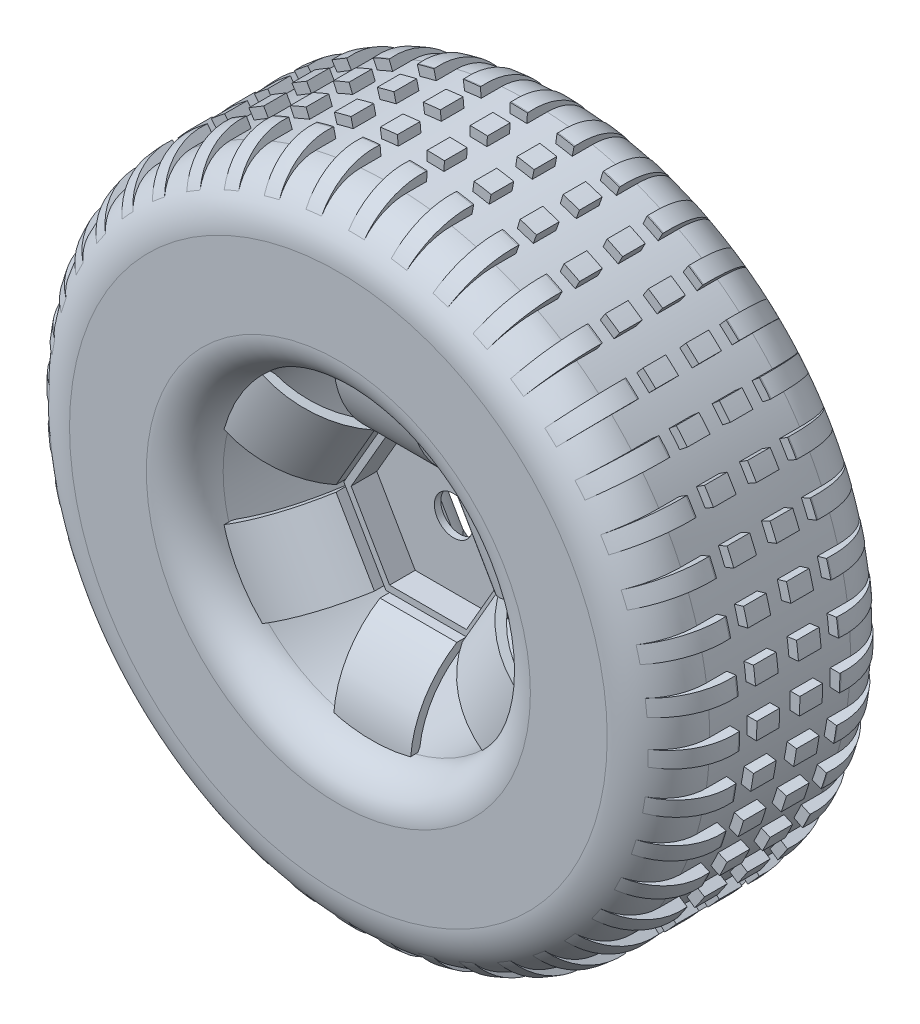
from build123d import *

# Parameters (mm, degrees)
SKETCH2_R                = 3
BOSS_EXTRUDE1_DEPTH      = 5
SHELL2_T                 = -1
SKETCH7_R                = 3
BOSS_EXTRUDE2_DEPTH      = 5
SHELL3_START             = -5
SHELL3_OUTLINE_R         = 3
SHELL3_DEPTH             = 5
SKETCH8_W                = 12
SKETCH8_H                = 3
CIRPATTERN7_COUNT        = 6
MIRROR1_COPY_1_SKETCH_W  = 12
MIRROR1_COPY_1_SKETCH_H  = 3
MIRROR1_COPY_2_SKETCH_W  = 12
MIRROR1_COPY_2_SKETCH_H  = 3
MIRROR1_COPY_3_SKETCH_W  = 12
MIRROR1_COPY_3_SKETCH_H  = 3
MIRROR1_COPY_4_SKETCH_W  = 12
MIRROR1_COPY_4_SKETCH_H  = 3
MIRROR1_COPY_5_SKETCH_W  = 12
MIRROR1_COPY_5_SKETCH_H  = 3
SKETCH12_W               = 3.543897996
SKETCH12_H               = 1.5
REVOLVE3_ANGLE           = 3
CIRPATTERN8_COUNT        = 44
MIRROR2_COPY_1_SKETCH_W  = 3.543897996
MIRROR2_COPY_1_SKETCH_H  = 1.5
MIRROR2_COPY_1_ANGLE     = 3
MIRROR2_COPY_2_SKETCH_W  = 3.543897996
MIRROR2_COPY_2_SKETCH_H  = 1.5
MIRROR2_COPY_2_ANGLE     = 3
MIRROR2_COPY_3_SKETCH_W  = 3.543897996
MIRROR2_COPY_3_SKETCH_H  = 1.5
MIRROR2_COPY_3_ANGLE     = 3
MIRROR2_COPY_4_SKETCH_W  = 3.543897996
MIRROR2_COPY_4_SKETCH_H  = 1.5
MIRROR2_COPY_4_ANGLE     = 3
MIRROR2_COPY_5_SKETCH_W  = 3.543897996
MIRROR2_COPY_5_SKETCH_H  = 1.5
MIRROR2_COPY_5_ANGLE     = 3
MIRROR2_COPY_6_SKETCH_W  = 3.543897996
MIRROR2_COPY_6_SKETCH_H  = 1.5
MIRROR2_COPY_6_ANGLE     = 3
MIRROR2_COPY_7_SKETCH_W  = 3.543897996
MIRROR2_COPY_7_SKETCH_H  = 1.5
MIRROR2_COPY_7_ANGLE     = 3
MIRROR2_COPY_8_SKETCH_W  = 3.543897996
MIRROR2_COPY_8_SKETCH_H  = 1.5
MIRROR2_COPY_8_ANGLE     = 3
MIRROR2_COPY_9_SKETCH_W  = 3.543897996
MIRROR2_COPY_9_SKETCH_H  = 1.5
MIRROR2_COPY_9_ANGLE     = 3
MIRROR2_COPY_10_SKETCH_W = 3.543897996
MIRROR2_COPY_10_SKETCH_H = 1.5
MIRROR2_COPY_10_ANGLE    = 3
MIRROR2_COPY_11_SKETCH_W = 3.543897996
MIRROR2_COPY_11_SKETCH_H = 1.5
MIRROR2_COPY_11_ANGLE    = 3
MIRROR2_COPY_12_SKETCH_W = 3.543897996
MIRROR2_COPY_12_SKETCH_H = 1.5
MIRROR2_COPY_12_ANGLE    = 3
MIRROR2_COPY_13_SKETCH_W = 3.543897996
MIRROR2_COPY_13_SKETCH_H = 1.5
MIRROR2_COPY_13_ANGLE    = 3
MIRROR2_COPY_14_SKETCH_W = 3.543897996
MIRROR2_COPY_14_SKETCH_H = 1.5
MIRROR2_COPY_14_ANGLE    = 3
MIRROR2_COPY_15_SKETCH_W = 3.543897996
MIRROR2_COPY_15_SKETCH_H = 1.5
MIRROR2_COPY_15_ANGLE    = 3
MIRROR2_COPY_16_SKETCH_W = 3.543897996
MIRROR2_COPY_16_SKETCH_H = 1.5
MIRROR2_COPY_16_ANGLE    = 3
MIRROR2_COPY_17_SKETCH_W = 3.543897996
MIRROR2_COPY_17_SKETCH_H = 1.5
MIRROR2_COPY_17_ANGLE    = 3
MIRROR2_COPY_18_SKETCH_W = 3.543897996
MIRROR2_COPY_18_SKETCH_H = 1.5
MIRROR2_COPY_18_ANGLE    = 3
MIRROR2_COPY_19_SKETCH_W = 3.543897996
MIRROR2_COPY_19_SKETCH_H = 1.5
MIRROR2_COPY_19_ANGLE    = 3
MIRROR2_COPY_20_SKETCH_W = 3.543897996
MIRROR2_COPY_20_SKETCH_H = 1.5
MIRROR2_COPY_20_ANGLE    = 3
MIRROR2_COPY_21_SKETCH_W = 3.543897996
MIRROR2_COPY_21_SKETCH_H = 1.5
MIRROR2_COPY_21_ANGLE    = 3
MIRROR2_COPY_22_SKETCH_W = 3.543897996
MIRROR2_COPY_22_SKETCH_H = 1.5
MIRROR2_COPY_22_ANGLE    = 3
MIRROR2_COPY_23_SKETCH_W = 3.543897996
MIRROR2_COPY_23_SKETCH_H = 1.5
MIRROR2_COPY_23_ANGLE    = 3
MIRROR2_COPY_24_SKETCH_W = 3.543897996
MIRROR2_COPY_24_SKETCH_H = 1.5
MIRROR2_COPY_24_ANGLE    = 3
MIRROR2_COPY_25_SKETCH_W = 3.543897996
MIRROR2_COPY_25_SKETCH_H = 1.5
MIRROR2_COPY_25_ANGLE    = 3
MIRROR2_COPY_26_SKETCH_W = 3.543897996
MIRROR2_COPY_26_SKETCH_H = 1.5
MIRROR2_COPY_26_ANGLE    = 3
MIRROR2_COPY_27_SKETCH_W = 3.543897996
MIRROR2_COPY_27_SKETCH_H = 1.5
MIRROR2_COPY_27_ANGLE    = 3
MIRROR2_COPY_28_SKETCH_W = 3.543897996
MIRROR2_COPY_28_SKETCH_H = 1.5
MIRROR2_COPY_28_ANGLE    = 3
MIRROR2_COPY_29_SKETCH_W = 3.543897996
MIRROR2_COPY_29_SKETCH_H = 1.5
MIRROR2_COPY_29_ANGLE    = 3
MIRROR2_COPY_30_SKETCH_W = 3.543897996
MIRROR2_COPY_30_SKETCH_H = 1.5
MIRROR2_COPY_30_ANGLE    = 3
MIRROR2_COPY_31_SKETCH_W = 3.543897996
MIRROR2_COPY_31_SKETCH_H = 1.5
MIRROR2_COPY_31_ANGLE    = 3
MIRROR2_COPY_32_SKETCH_W = 3.543897996
MIRROR2_COPY_32_SKETCH_H = 1.5
MIRROR2_COPY_32_ANGLE    = 3
MIRROR2_COPY_33_SKETCH_W = 3.543897996
MIRROR2_COPY_33_SKETCH_H = 1.5
MIRROR2_COPY_33_ANGLE    = 3
MIRROR2_COPY_34_SKETCH_W = 3.543897996
MIRROR2_COPY_34_SKETCH_H = 1.5
MIRROR2_COPY_34_ANGLE    = 3
MIRROR2_COPY_35_SKETCH_W = 3.543897996
MIRROR2_COPY_35_SKETCH_H = 1.5
MIRROR2_COPY_35_ANGLE    = 3
MIRROR2_COPY_36_SKETCH_W = 3.543897996
MIRROR2_COPY_36_SKETCH_H = 1.5
MIRROR2_COPY_36_ANGLE    = 3
MIRROR2_COPY_37_SKETCH_W = 3.543897996
MIRROR2_COPY_37_SKETCH_H = 1.5
MIRROR2_COPY_37_ANGLE    = 3
MIRROR2_COPY_38_SKETCH_W = 3.543897996
MIRROR2_COPY_38_SKETCH_H = 1.5
MIRROR2_COPY_38_ANGLE    = 3
MIRROR2_COPY_39_SKETCH_W = 3.543897996
MIRROR2_COPY_39_SKETCH_H = 1.5
MIRROR2_COPY_39_ANGLE    = 3
MIRROR2_COPY_40_SKETCH_W = 3.543897996
MIRROR2_COPY_40_SKETCH_H = 1.5
MIRROR2_COPY_40_ANGLE    = 3
MIRROR2_COPY_41_SKETCH_W = 3.543897996
MIRROR2_COPY_41_SKETCH_H = 1.5
MIRROR2_COPY_41_ANGLE    = 3
MIRROR2_COPY_42_SKETCH_W = 3.543897996
MIRROR2_COPY_42_SKETCH_H = 1.5
MIRROR2_COPY_42_ANGLE    = 3
MIRROR2_COPY_43_SKETCH_W = 3.543897996
MIRROR2_COPY_43_SKETCH_H = 1.5
MIRROR2_COPY_43_ANGLE    = 3


# Read off the part's stored shape, not the designer's step: Shell3
with BuildPart() as part:
    # Sketch1 → Revolve2 (revolve)
    with BuildSketch(Plane(origin=(0, 0, 0), x_dir=(0, 0, -1), z_dir=(1, 0, 0)), mode=Mode.PRIVATE) as revolve2_sk:
        with BuildLine():
            Line((-13, 24), (13, 24))
            ThreePointArc((13, 24), (17.242640687, 25.757359313), (19, 30))
            Line((19, 30), (19, 42))
            ThreePointArc((19, 42), (16.656854249, 47.656854249), (11, 50))
            Line((11, 50), (-11, 50))
            ThreePointArc((-11, 50), (-16.656854249, 47.656854249), (-19, 42))
            Line((-19, 42), (-19, 30))
            ThreePointArc((-19, 30), (-17.242640687, 25.757359313), (-13, 24))
        make_face()
    revolve(revolve2_sk.sketch.rotate(Axis((0, 0, 0), (0, 0, -1)), 90), axis=Axis((0, 0, 0), (0, 0, -1)))



with BuildPart() as body_2:
    # Sketch2 → Boss-Extrude1 (new body)
    with BuildSketch(Plane.XY):
        Polygon((6.577350269, 11.392304845), (-6.577350269, 11.392304845), (-13.154700538, 0), (-6.577350269, -11.392304845), (6.577350269, -11.392304845), (13.154700538, 0), align=None)
        Circle(SKETCH2_R, mode=Mode.SUBTRACT)
    extrude(amount=BOSS_EXTRUDE1_DEPTH)

    # Shell2
    shell2_openings = [body_2.faces().sort_by_distance(p)[0] for p in [
        (0, 11.044264183, 5),
        (-3, 0, 2.5),
    ]]
    offset(amount=SHELL2_T, openings=shell2_openings, kind=Kind.INTERSECTION)

    # Sketch7 → Boss-Extrude2 (add)
    with BuildSketch(Plane(origin=(0, 0, 0), x_dir=(-1, 0, 0), z_dir=(0, 0, -1))):
        Polygon((13.154700538, 0), (6.577350269, 11.392304845), (-6.577350269, 11.392304845), (-13.154700538, 0), (-6.577350269, -11.392304845), (6.577350269, -11.392304845), align=None)
        Circle(SKETCH7_R, mode=Mode.SUBTRACT)
    extrude(amount=BOSS_EXTRUDE2_DEPTH)

    # Shell3 outline → Shell3 (cut)
    with BuildSketch(Plane.XY.offset(SHELL3_START)):
        Polygon((6, 10.392304845), (-6, 10.392304845), (-12, 0), (-6, -10.392304845), (6, -10.392304845), (12, 0), align=None)
        Circle(SHELL3_OUTLINE_R, mode=Mode.SUBTRACT)
    extrude(amount=SHELL3_DEPTH, mode=Mode.SUBTRACT)


with BuildPart() as part_1:
    add(part.part)

    add(body_2.part)  # Sweep1 merges body 2
    # Sweep1: sweep along a path in Sketch9
    with BuildLine(Plane(origin=(0, 0, 0), x_dir=(0, 0, -1), z_dir=(1, 0, 0))) as sweep1_path:
        ThreePointArc((5, 11.392304845), (10.725518806, 16.601253611), (13, 24))
    # Sketch8 → Sweep1 (sweep)
    with BuildSketch(Plane(origin=(0, 11.392304845, 0), x_dir=(1, 0, 0), z_dir=(0, 1, 0))):
        with Locations((0, 5)):
            Rectangle(SKETCH8_W, SKETCH8_H)
    sweep1 = sweep(path=sweep1_path.line)

    # CirPattern7: Sweep1 ×6 about axis
    cirpattern7_axis = Axis((0, 0, 0), (0, 0, 1))
    for i in range(1, CIRPATTERN7_COUNT):
        add(sweep1.rotate(cirpattern7_axis, i * 360 / CIRPATTERN7_COUNT))

    # Mirror1: Sweep1 across plane
    add(sweep1.mirror(Plane.XY))

    # Mirror1 copy 1: sweep along a path in Mirror1 copy 1 path
    with BuildLine(Plane(origin=(0, 0, 0), x_dir=(0, 0, 1), z_dir=(0.5000000000000001, 0.8660254037844386, 0))) as mirror1_copy_1_path:
        ThreePointArc((5, -11.392304845), (10.725518806, -16.601253611), (13, -24))
    # Mirror1 copy 1 sketch → Mirror1 copy 1 (sweep)
    with BuildSketch(Plane(origin=(-9.866025404, 5.696152423, 0), x_dir=(0.5000000000000001, 0.8660254037844386, 0), z_dir=(-0.8660254037844386, 0.5000000000000001, 0))):
        with Locations((0, -5)):
            Rectangle(MIRROR1_COPY_1_SKETCH_W, MIRROR1_COPY_1_SKETCH_H)
    sweep(path=mirror1_copy_1_path.line)

    # Mirror1 copy 2: sweep along a path in Mirror1 copy 2 path
    with BuildLine(Plane(origin=(0, 0, 0), x_dir=(0, 0, 1), z_dir=(-0.4999999999999998, 0.8660254037844387, 0))) as mirror1_copy_2_path:
        ThreePointArc((5, -11.392304845), (10.725518806, -16.601253611), (13, -24))
    # Mirror1 copy 2 sketch → Mirror1 copy 2 (sweep)
    with BuildSketch(Plane(origin=(-9.866025404, -5.696152423, 0), x_dir=(-0.4999999999999998, 0.8660254037844387, 0), z_dir=(-0.8660254037844387, -0.4999999999999998, 0))):
        with Locations((0, -5)):
            Rectangle(MIRROR1_COPY_2_SKETCH_W, MIRROR1_COPY_2_SKETCH_H)
    sweep(path=mirror1_copy_2_path.line)

    # Mirror1 copy 3: sweep along a path in Mirror1 copy 3 path
    with BuildLine(Plane.ZY) as mirror1_copy_3_path:
        ThreePointArc((5, -11.392304845), (10.725518806, -16.601253611), (13, -24))
    # Mirror1 copy 3 sketch → Mirror1 copy 3 (sweep)
    with BuildSketch(Plane(origin=(0, -11.392304845, 0), x_dir=(-1, 0, 0), z_dir=(0, -1, 0))):
        with Locations((0, -5)):
            Rectangle(MIRROR1_COPY_3_SKETCH_W, MIRROR1_COPY_3_SKETCH_H)
    sweep(path=mirror1_copy_3_path.line)

    # Mirror1 copy 4: sweep along a path in Mirror1 copy 4 path
    with BuildLine(Plane(origin=(0, 0, 0), x_dir=(0, 0, 1), z_dir=(-0.5000000000000004, -0.8660254037844384, 0))) as mirror1_copy_4_path:
        ThreePointArc((5, -11.392304845), (10.725518806, -16.601253611), (13, -24))
    # Mirror1 copy 4 sketch → Mirror1 copy 4 (sweep)
    with BuildSketch(Plane(origin=(9.866025404, -5.696152423, 0), x_dir=(-0.5000000000000004, -0.8660254037844384, 0), z_dir=(0.8660254037844384, -0.5000000000000004, 0))):
        with Locations((0, -5)):
            Rectangle(MIRROR1_COPY_4_SKETCH_W, MIRROR1_COPY_4_SKETCH_H)
    sweep(path=mirror1_copy_4_path.line)

    # Mirror1 copy 5: sweep along a path in Mirror1 copy 5 path
    with BuildLine(Plane(origin=(0, 0, 0), x_dir=(0, 0, 1), z_dir=(0.5000000000000001, -0.8660254037844386, 0))) as mirror1_copy_5_path:
        ThreePointArc((5, -11.392304845), (10.725518806, -16.601253611), (13, -24))
    # Mirror1 copy 5 sketch → Mirror1 copy 5 (sweep)
    with BuildSketch(Plane(origin=(9.866025404, 5.696152423, 0), x_dir=(0.5000000000000001, -0.8660254037844386, 0), z_dir=(0.8660254037844386, 0.5000000000000001, 0))):
        with Locations((0, -5)):
            Rectangle(MIRROR1_COPY_5_SKETCH_W, MIRROR1_COPY_5_SKETCH_H)
    sweep(path=mirror1_copy_5_path.line)

    # Sketch12 → Revolve3 (revolve)
    with BuildSketch(Plane(origin=(0, 0, 0), x_dir=(0, 0, -1), z_dir=(1, 0, 0))):
        with BuildLine():
            Line((8, 51.5), (7.833879781, 51.5))
            Line((7.833879781, 51.5), (7.833879781, 50))
            Line((7.833879781, 50), (11, 50))
            ThreePointArc((11, 50), (16.488186044, 47.488186044), (19, 42))
            ThreePointArc((19, 42), (15.467514421, 49.028174593), (8, 51.5))
        make_face()
        with Locations((3.357377049, 50.75)):
            Rectangle(SKETCH12_W, SKETCH12_H)
    revolve3 = revolve(axis=Axis((0, 0, 0), (0, 0, -1)), revolution_arc=REVOLVE3_ANGLE)

    # CirPattern8: Revolve3 ×44 about axis
    cirpattern8_axis = Axis((0, 0, 0), (0, 0, 1))
    for i in range(1, CIRPATTERN8_COUNT):
        add(revolve3.rotate(cirpattern8_axis, i * 360 / CIRPATTERN8_COUNT))

    # Mirror2: Revolve3 across plane
    add(revolve3.mirror(Plane.XY))

    # Mirror2 copy 1 sketch → Mirror2 copy 1 (revolve)
    with BuildSketch(Plane(origin=(0, 0, 0), x_dir=(0, 0, 1), z_dir=(0.9898214418809327, 0.14231483827328514, 0))):
        with BuildLine():
            Line((8, -51.5), (7.833879781, -51.5))
            Line((7.833879781, -51.5), (7.833879781, -50))
            Line((7.833879781, -50), (11, -50))
            ThreePointArc((11, -50), (16.488186044, -47.488186044), (19, -42))
            ThreePointArc((19, -42), (15.467514421, -49.028174593), (8, -51.5))
        make_face()
        with Locations((3.357377049, -50.75)):
            Rectangle(MIRROR2_COPY_1_SKETCH_W, MIRROR2_COPY_1_SKETCH_H)
    revolve(axis=Axis((0, 0, 0), (0, 0, -1)), revolution_arc=MIRROR2_COPY_1_ANGLE)

    # Mirror2 copy 2 sketch → Mirror2 copy 2 (revolve)
    with BuildSketch(Plane(origin=(0, 0, 0), x_dir=(0, 0, 1), z_dir=(0.9594929736144974, 0.28173255684142967, 0))):
        with BuildLine():
            Line((8, -51.5), (7.833879781, -51.5))
            Line((7.833879781, -51.5), (7.833879781, -50))
            Line((7.833879781, -50), (11, -50))
            ThreePointArc((11, -50), (16.488186044, -47.488186044), (19, -42))
            ThreePointArc((19, -42), (15.467514421, -49.028174593), (8, -51.5))
        make_face()
        with Locations((3.357377049, -50.75)):
            Rectangle(MIRROR2_COPY_2_SKETCH_W, MIRROR2_COPY_2_SKETCH_H)
    revolve(axis=Axis((0, 0, 0), (0, 0, -1)), revolution_arc=MIRROR2_COPY_2_ANGLE)

    # Mirror2 copy 3 sketch → Mirror2 copy 3 (revolve)
    with BuildSketch(Plane(origin=(0, 0, 0), x_dir=(0, 0, 1), z_dir=(0.9096319953545183, 0.41541501300188644, 0))):
        with BuildLine():
            Line((8, -51.5), (7.833879781, -51.5))
            Line((7.833879781, -51.5), (7.833879781, -50))
            Line((7.833879781, -50), (11, -50))
            ThreePointArc((11, -50), (16.488186044, -47.488186044), (19, -42))
            ThreePointArc((19, -42), (15.467514421, -49.028174593), (8, -51.5))
        make_face()
        with Locations((3.357377049, -50.75)):
            Rectangle(MIRROR2_COPY_3_SKETCH_W, MIRROR2_COPY_3_SKETCH_H)
    revolve(axis=Axis((0, 0, 0), (0, 0, -1)), revolution_arc=MIRROR2_COPY_3_ANGLE)

    # Mirror2 copy 4 sketch → Mirror2 copy 4 (revolve)
    with BuildSketch(Plane(origin=(0, 0, 0), x_dir=(0, 0, 1), z_dir=(0.8412535328311812, 0.5406408174555976, 0))):
        with BuildLine():
            Line((8, -51.5), (7.833879781, -51.5))
            Line((7.833879781, -51.5), (7.833879781, -50))
            Line((7.833879781, -50), (11, -50))
            ThreePointArc((11, -50), (16.488186044, -47.488186044), (19, -42))
            ThreePointArc((19, -42), (15.467514421, -49.028174593), (8, -51.5))
        make_face()
        with Locations((3.357377049, -50.75)):
            Rectangle(MIRROR2_COPY_4_SKETCH_W, MIRROR2_COPY_4_SKETCH_H)
    revolve(axis=Axis((0, 0, 0), (0, 0, -1)), revolution_arc=MIRROR2_COPY_4_ANGLE)

    # Mirror2 copy 5 sketch → Mirror2 copy 5 (revolve)
    with BuildSketch(Plane(origin=(0, 0, 0), x_dir=(0, 0, 1), z_dir=(0.7557495743542584, 0.654860733945285, 0))):
        with BuildLine():
            Line((8, -51.5), (7.833879781, -51.5))
            Line((7.833879781, -51.5), (7.833879781, -50))
            Line((7.833879781, -50), (11, -50))
            ThreePointArc((11, -50), (16.488186044, -47.488186044), (19, -42))
            ThreePointArc((19, -42), (15.467514421, -49.028174593), (8, -51.5))
        make_face()
        with Locations((3.357377049, -50.75)):
            Rectangle(MIRROR2_COPY_5_SKETCH_W, MIRROR2_COPY_5_SKETCH_H)
    revolve(axis=Axis((0, 0, 0), (0, 0, -1)), revolution_arc=MIRROR2_COPY_5_ANGLE)

    # Mirror2 copy 6 sketch → Mirror2 copy 6 (revolve)
    with BuildSketch(Plane(origin=(0, 0, 0), x_dir=(0, 0, 1), z_dir=(0.654860733945285, 0.7557495743542583, 0))):
        with BuildLine():
            Line((8, -51.5), (7.833879781, -51.5))
            Line((7.833879781, -51.5), (7.833879781, -50))
            Line((7.833879781, -50), (11, -50))
            ThreePointArc((11, -50), (16.488186044, -47.488186044), (19, -42))
            ThreePointArc((19, -42), (15.467514421, -49.028174593), (8, -51.5))
        make_face()
        with Locations((3.357377049, -50.75)):
            Rectangle(MIRROR2_COPY_6_SKETCH_W, MIRROR2_COPY_6_SKETCH_H)
    revolve(axis=Axis((0, 0, 0), (0, 0, -1)), revolution_arc=MIRROR2_COPY_6_ANGLE)

    # Mirror2 copy 7 sketch → Mirror2 copy 7 (revolve)
    with BuildSketch(Plane(origin=(0, 0, 0), x_dir=(0, 0, 1), z_dir=(0.5406408174555977, 0.8412535328311811, 0))):
        with BuildLine():
            Line((8, -51.5), (7.833879781, -51.5))
            Line((7.833879781, -51.5), (7.833879781, -50))
            Line((7.833879781, -50), (11, -50))
            ThreePointArc((11, -50), (16.488186044, -47.488186044), (19, -42))
            ThreePointArc((19, -42), (15.467514421, -49.028174593), (8, -51.5))
        make_face()
        with Locations((3.357377049, -50.75)):
            Rectangle(MIRROR2_COPY_7_SKETCH_W, MIRROR2_COPY_7_SKETCH_H)
    revolve(axis=Axis((0, 0, 0), (0, 0, -1)), revolution_arc=MIRROR2_COPY_7_ANGLE)

    # Mirror2 copy 8 sketch → Mirror2 copy 8 (revolve)
    with BuildSketch(Plane(origin=(0, 0, 0), x_dir=(0, 0, 1), z_dir=(0.41541501300188644, 0.9096319953545183, 0))):
        with BuildLine():
            Line((8, -51.5), (7.833879781, -51.5))
            Line((7.833879781, -51.5), (7.833879781, -50))
            Line((7.833879781, -50), (11, -50))
            ThreePointArc((11, -50), (16.488186044, -47.488186044), (19, -42))
            ThreePointArc((19, -42), (15.467514421, -49.028174593), (8, -51.5))
        make_face()
        with Locations((3.357377049, -50.75)):
            Rectangle(MIRROR2_COPY_8_SKETCH_W, MIRROR2_COPY_8_SKETCH_H)
    revolve(axis=Axis((0, 0, 0), (0, 0, -1)), revolution_arc=MIRROR2_COPY_8_ANGLE)

    # Mirror2 copy 9 sketch → Mirror2 copy 9 (revolve)
    with BuildSketch(Plane(origin=(0, 0, 0), x_dir=(0, 0, 1), z_dir=(0.2817325568414296, 0.9594929736144974, 0))):
        with BuildLine():
            Line((8, -51.5), (7.833879781, -51.5))
            Line((7.833879781, -51.5), (7.833879781, -50))
            Line((7.833879781, -50), (11, -50))
            ThreePointArc((11, -50), (16.488186044, -47.488186044), (19, -42))
            ThreePointArc((19, -42), (15.467514421, -49.028174593), (8, -51.5))
        make_face()
        with Locations((3.357377049, -50.75)):
            Rectangle(MIRROR2_COPY_9_SKETCH_W, MIRROR2_COPY_9_SKETCH_H)
    revolve(axis=Axis((0, 0, 0), (0, 0, -1)), revolution_arc=MIRROR2_COPY_9_ANGLE)

    # Mirror2 copy 10 sketch → Mirror2 copy 10 (revolve)
    with BuildSketch(Plane(origin=(0, 0, 0), x_dir=(0, 0, 1), z_dir=(0.14231483827328534, 0.9898214418809327, 0))):
        with BuildLine():
            Line((8, -51.5), (7.833879781, -51.5))
            Line((7.833879781, -51.5), (7.833879781, -50))
            Line((7.833879781, -50), (11, -50))
            ThreePointArc((11, -50), (16.488186044, -47.488186044), (19, -42))
            ThreePointArc((19, -42), (15.467514421, -49.028174593), (8, -51.5))
        make_face()
        with Locations((3.357377049, -50.75)):
            Rectangle(MIRROR2_COPY_10_SKETCH_W, MIRROR2_COPY_10_SKETCH_H)
    revolve(axis=Axis((0, 0, 0), (0, 0, -1)), revolution_arc=MIRROR2_COPY_10_ANGLE)

    # Mirror2 copy 11 sketch → Mirror2 copy 11 (revolve)
    with BuildSketch(Plane.ZX):
        with BuildLine():
            Line((8, -51.5), (7.833879781, -51.5))
            Line((7.833879781, -51.5), (7.833879781, -50))
            Line((7.833879781, -50), (11, -50))
            ThreePointArc((11, -50), (16.488186044, -47.488186044), (19, -42))
            ThreePointArc((19, -42), (15.467514421, -49.028174593), (8, -51.5))
        make_face()
        with Locations((3.357377049, -50.75)):
            Rectangle(MIRROR2_COPY_11_SKETCH_W, MIRROR2_COPY_11_SKETCH_H)
    revolve(axis=Axis((0, 0, 0), (0, 0, -1)), revolution_arc=MIRROR2_COPY_11_ANGLE)

    # Mirror2 copy 12 sketch → Mirror2 copy 12 (revolve)
    with BuildSketch(Plane(origin=(0, 0, 0), x_dir=(0, 0, 1), z_dir=(-0.14231483827328523, 0.9898214418809327, 0))):
        with BuildLine():
            Line((8, -51.5), (7.833879781, -51.5))
            Line((7.833879781, -51.5), (7.833879781, -50))
            Line((7.833879781, -50), (11, -50))
            ThreePointArc((11, -50), (16.488186044, -47.488186044), (19, -42))
            ThreePointArc((19, -42), (15.467514421, -49.028174593), (8, -51.5))
        make_face()
        with Locations((3.357377049, -50.75)):
            Rectangle(MIRROR2_COPY_12_SKETCH_W, MIRROR2_COPY_12_SKETCH_H)
    revolve(axis=Axis((0, 0, 0), (0, 0, -1)), revolution_arc=MIRROR2_COPY_12_ANGLE)

    # Mirror2 copy 13 sketch → Mirror2 copy 13 (revolve)
    with BuildSketch(Plane(origin=(0, 0, 0), x_dir=(0, 0, 1), z_dir=(-0.28173255684142967, 0.9594929736144974, 0))):
        with BuildLine():
            Line((8, -51.5), (7.833879781, -51.5))
            Line((7.833879781, -51.5), (7.833879781, -50))
            Line((7.833879781, -50), (11, -50))
            ThreePointArc((11, -50), (16.488186044, -47.488186044), (19, -42))
            ThreePointArc((19, -42), (15.467514421, -49.028174593), (8, -51.5))
        make_face()
        with Locations((3.357377049, -50.75)):
            Rectangle(MIRROR2_COPY_13_SKETCH_W, MIRROR2_COPY_13_SKETCH_H)
    revolve(axis=Axis((0, 0, 0), (0, 0, -1)), revolution_arc=MIRROR2_COPY_13_ANGLE)

    # Mirror2 copy 14 sketch → Mirror2 copy 14 (revolve)
    with BuildSketch(Plane(origin=(0, 0, 0), x_dir=(0, 0, 1), z_dir=(-0.4154150130018863, 0.9096319953545184, 0))):
        with BuildLine():
            Line((8, -51.5), (7.833879781, -51.5))
            Line((7.833879781, -51.5), (7.833879781, -50))
            Line((7.833879781, -50), (11, -50))
            ThreePointArc((11, -50), (16.488186044, -47.488186044), (19, -42))
            ThreePointArc((19, -42), (15.467514421, -49.028174593), (8, -51.5))
        make_face()
        with Locations((3.357377049, -50.75)):
            Rectangle(MIRROR2_COPY_14_SKETCH_W, MIRROR2_COPY_14_SKETCH_H)
    revolve(axis=Axis((0, 0, 0), (0, 0, -1)), revolution_arc=MIRROR2_COPY_14_ANGLE)

    # Mirror2 copy 15 sketch → Mirror2 copy 15 (revolve)
    with BuildSketch(Plane(origin=(0, 0, 0), x_dir=(0, 0, 1), z_dir=(-0.5406408174555977, 0.8412535328311811, 0))):
        with BuildLine():
            Line((8, -51.5), (7.833879781, -51.5))
            Line((7.833879781, -51.5), (7.833879781, -50))
            Line((7.833879781, -50), (11, -50))
            ThreePointArc((11, -50), (16.488186044, -47.488186044), (19, -42))
            ThreePointArc((19, -42), (15.467514421, -49.028174593), (8, -51.5))
        make_face()
        with Locations((3.357377049, -50.75)):
            Rectangle(MIRROR2_COPY_15_SKETCH_W, MIRROR2_COPY_15_SKETCH_H)
    revolve(axis=Axis((0, 0, 0), (0, 0, -1)), revolution_arc=MIRROR2_COPY_15_ANGLE)

    # Mirror2 copy 16 sketch → Mirror2 copy 16 (revolve)
    with BuildSketch(Plane(origin=(0, 0, 0), x_dir=(0, 0, 1), z_dir=(-0.654860733945285, 0.7557495743542583, 0))):
        with BuildLine():
            Line((8, -51.5), (7.833879781, -51.5))
            Line((7.833879781, -51.5), (7.833879781, -50))
            Line((7.833879781, -50), (11, -50))
            ThreePointArc((11, -50), (16.488186044, -47.488186044), (19, -42))
            ThreePointArc((19, -42), (15.467514421, -49.028174593), (8, -51.5))
        make_face()
        with Locations((3.357377049, -50.75)):
            Rectangle(MIRROR2_COPY_16_SKETCH_W, MIRROR2_COPY_16_SKETCH_H)
    revolve(axis=Axis((0, 0, 0), (0, 0, -1)), revolution_arc=MIRROR2_COPY_16_ANGLE)

    # Mirror2 copy 17 sketch → Mirror2 copy 17 (revolve)
    with BuildSketch(Plane(origin=(0, 0, 0), x_dir=(0, 0, 1), z_dir=(-0.7557495743542582, 0.6548607339452852, 0))):
        with BuildLine():
            Line((8, -51.5), (7.833879781, -51.5))
            Line((7.833879781, -51.5), (7.833879781, -50))
            Line((7.833879781, -50), (11, -50))
            ThreePointArc((11, -50), (16.488186044, -47.488186044), (19, -42))
            ThreePointArc((19, -42), (15.467514421, -49.028174593), (8, -51.5))
        make_face()
        with Locations((3.357377049, -50.75)):
            Rectangle(MIRROR2_COPY_17_SKETCH_W, MIRROR2_COPY_17_SKETCH_H)
    revolve(axis=Axis((0, 0, 0), (0, 0, -1)), revolution_arc=MIRROR2_COPY_17_ANGLE)

    # Mirror2 copy 18 sketch → Mirror2 copy 18 (revolve)
    with BuildSketch(Plane(origin=(0, 0, 0), x_dir=(0, 0, 1), z_dir=(-0.8412535328311813, 0.5406408174555974, 0))):
        with BuildLine():
            Line((8, -51.5), (7.833879781, -51.5))
            Line((7.833879781, -51.5), (7.833879781, -50))
            Line((7.833879781, -50), (11, -50))
            ThreePointArc((11, -50), (16.488186044, -47.488186044), (19, -42))
            ThreePointArc((19, -42), (15.467514421, -49.028174593), (8, -51.5))
        make_face()
        with Locations((3.357377049, -50.75)):
            Rectangle(MIRROR2_COPY_18_SKETCH_W, MIRROR2_COPY_18_SKETCH_H)
    revolve(axis=Axis((0, 0, 0), (0, 0, -1)), revolution_arc=MIRROR2_COPY_18_ANGLE)

    # Mirror2 copy 19 sketch → Mirror2 copy 19 (revolve)
    with BuildSketch(Plane(origin=(0, 0, 0), x_dir=(0, 0, 1), z_dir=(-0.9096319953545182, 0.4154150130018867, 0))):
        with BuildLine():
            Line((8, -51.5), (7.833879781, -51.5))
            Line((7.833879781, -51.5), (7.833879781, -50))
            Line((7.833879781, -50), (11, -50))
            ThreePointArc((11, -50), (16.488186044, -47.488186044), (19, -42))
            ThreePointArc((19, -42), (15.467514421, -49.028174593), (8, -51.5))
        make_face()
        with Locations((3.357377049, -50.75)):
            Rectangle(MIRROR2_COPY_19_SKETCH_W, MIRROR2_COPY_19_SKETCH_H)
    revolve(axis=Axis((0, 0, 0), (0, 0, -1)), revolution_arc=MIRROR2_COPY_19_ANGLE)

    # Mirror2 copy 20 sketch → Mirror2 copy 20 (revolve)
    with BuildSketch(Plane(origin=(0, 0, 0), x_dir=(0, 0, 1), z_dir=(-0.9594929736144973, 0.28173255684143006, 0))):
        with BuildLine():
            Line((8, -51.5), (7.833879781, -51.5))
            Line((7.833879781, -51.5), (7.833879781, -50))
            Line((7.833879781, -50), (11, -50))
            ThreePointArc((11, -50), (16.488186044, -47.488186044), (19, -42))
            ThreePointArc((19, -42), (15.467514421, -49.028174593), (8, -51.5))
        make_face()
        with Locations((3.357377049, -50.75)):
            Rectangle(MIRROR2_COPY_20_SKETCH_W, MIRROR2_COPY_20_SKETCH_H)
    revolve(axis=Axis((0, 0, 0), (0, 0, -1)), revolution_arc=MIRROR2_COPY_20_ANGLE)

    # Mirror2 copy 21 sketch → Mirror2 copy 21 (revolve)
    with BuildSketch(Plane(origin=(0, 0, 0), x_dir=(0, 0, 1), z_dir=(-0.9898214418809327, 0.14231483827328517, 0))):
        with BuildLine():
            Line((8, -51.5), (7.833879781, -51.5))
            Line((7.833879781, -51.5), (7.833879781, -50))
            Line((7.833879781, -50), (11, -50))
            ThreePointArc((11, -50), (16.488186044, -47.488186044), (19, -42))
            ThreePointArc((19, -42), (15.467514421, -49.028174593), (8, -51.5))
        make_face()
        with Locations((3.357377049, -50.75)):
            Rectangle(MIRROR2_COPY_21_SKETCH_W, MIRROR2_COPY_21_SKETCH_H)
    revolve(axis=Axis((0, 0, 0), (0, 0, -1)), revolution_arc=MIRROR2_COPY_21_ANGLE)

    # Mirror2 copy 22 sketch → Mirror2 copy 22 (revolve)
    with BuildSketch(Plane.ZY):
        with BuildLine():
            Line((8, -51.5), (7.833879781, -51.5))
            Line((7.833879781, -51.5), (7.833879781, -50))
            Line((7.833879781, -50), (11, -50))
            ThreePointArc((11, -50), (16.488186044, -47.488186044), (19, -42))
            ThreePointArc((19, -42), (15.467514421, -49.028174593), (8, -51.5))
        make_face()
        with Locations((3.357377049, -50.75)):
            Rectangle(MIRROR2_COPY_22_SKETCH_W, MIRROR2_COPY_22_SKETCH_H)
    revolve(axis=Axis((0, 0, 0), (0, 0, -1)), revolution_arc=MIRROR2_COPY_22_ANGLE)

    # Mirror2 copy 23 sketch → Mirror2 copy 23 (revolve)
    with BuildSketch(Plane(origin=(0, 0, 0), x_dir=(0, 0, 1), z_dir=(-0.9898214418809327, -0.14231483827328537, 0))):
        with BuildLine():
            Line((8, -51.5), (7.833879781, -51.5))
            Line((7.833879781, -51.5), (7.833879781, -50))
            Line((7.833879781, -50), (11, -50))
            ThreePointArc((11, -50), (16.488186044, -47.488186044), (19, -42))
            ThreePointArc((19, -42), (15.467514421, -49.028174593), (8, -51.5))
        make_face()
        with Locations((3.357377049, -50.75)):
            Rectangle(MIRROR2_COPY_23_SKETCH_W, MIRROR2_COPY_23_SKETCH_H)
    revolve(axis=Axis((0, 0, 0), (0, 0, -1)), revolution_arc=MIRROR2_COPY_23_ANGLE)

    # Mirror2 copy 24 sketch → Mirror2 copy 24 (revolve)
    with BuildSketch(Plane(origin=(0, 0, 0), x_dir=(0, 0, 1), z_dir=(-0.9594929736144974, -0.28173255684142984, 0))):
        with BuildLine():
            Line((8, -51.5), (7.833879781, -51.5))
            Line((7.833879781, -51.5), (7.833879781, -50))
            Line((7.833879781, -50), (11, -50))
            ThreePointArc((11, -50), (16.488186044, -47.488186044), (19, -42))
            ThreePointArc((19, -42), (15.467514421, -49.028174593), (8, -51.5))
        make_face()
        with Locations((3.357377049, -50.75)):
            Rectangle(MIRROR2_COPY_24_SKETCH_W, MIRROR2_COPY_24_SKETCH_H)
    revolve(axis=Axis((0, 0, 0), (0, 0, -1)), revolution_arc=MIRROR2_COPY_24_ANGLE)

    # Mirror2 copy 25 sketch → Mirror2 copy 25 (revolve)
    with BuildSketch(Plane(origin=(0, 0, 0), x_dir=(0, 0, 1), z_dir=(-0.9096319953545186, -0.4154150130018861, 0))):
        with BuildLine():
            Line((8, -51.5), (7.833879781, -51.5))
            Line((7.833879781, -51.5), (7.833879781, -50))
            Line((7.833879781, -50), (11, -50))
            ThreePointArc((11, -50), (16.488186044, -47.488186044), (19, -42))
            ThreePointArc((19, -42), (15.467514421, -49.028174593), (8, -51.5))
        make_face()
        with Locations((3.357377049, -50.75)):
            Rectangle(MIRROR2_COPY_25_SKETCH_W, MIRROR2_COPY_25_SKETCH_H)
    revolve(axis=Axis((0, 0, 0), (0, 0, -1)), revolution_arc=MIRROR2_COPY_25_ANGLE)

    # Mirror2 copy 26 sketch → Mirror2 copy 26 (revolve)
    with BuildSketch(Plane(origin=(0, 0, 0), x_dir=(0, 0, 1), z_dir=(-0.8412535328311812, -0.5406408174555976, 0))):
        with BuildLine():
            Line((8, -51.5), (7.833879781, -51.5))
            Line((7.833879781, -51.5), (7.833879781, -50))
            Line((7.833879781, -50), (11, -50))
            ThreePointArc((11, -50), (16.488186044, -47.488186044), (19, -42))
            ThreePointArc((19, -42), (15.467514421, -49.028174593), (8, -51.5))
        make_face()
        with Locations((3.357377049, -50.75)):
            Rectangle(MIRROR2_COPY_26_SKETCH_W, MIRROR2_COPY_26_SKETCH_H)
    revolve(axis=Axis((0, 0, 0), (0, 0, -1)), revolution_arc=MIRROR2_COPY_26_ANGLE)

    # Mirror2 copy 27 sketch → Mirror2 copy 27 (revolve)
    with BuildSketch(Plane(origin=(0, 0, 0), x_dir=(0, 0, 1), z_dir=(-0.7557495743542584, -0.654860733945285, 0))):
        with BuildLine():
            Line((8, -51.5), (7.833879781, -51.5))
            Line((7.833879781, -51.5), (7.833879781, -50))
            Line((7.833879781, -50), (11, -50))
            ThreePointArc((11, -50), (16.488186044, -47.488186044), (19, -42))
            ThreePointArc((19, -42), (15.467514421, -49.028174593), (8, -51.5))
        make_face()
        with Locations((3.357377049, -50.75)):
            Rectangle(MIRROR2_COPY_27_SKETCH_W, MIRROR2_COPY_27_SKETCH_H)
    revolve(axis=Axis((0, 0, 0), (0, 0, -1)), revolution_arc=MIRROR2_COPY_27_ANGLE)

    # Mirror2 copy 28 sketch → Mirror2 copy 28 (revolve)
    with BuildSketch(Plane(origin=(0, 0, 0), x_dir=(0, 0, 1), z_dir=(-0.6548607339452852, -0.7557495743542582, 0))):
        with BuildLine():
            Line((8, -51.5), (7.833879781, -51.5))
            Line((7.833879781, -51.5), (7.833879781, -50))
            Line((7.833879781, -50), (11, -50))
            ThreePointArc((11, -50), (16.488186044, -47.488186044), (19, -42))
            ThreePointArc((19, -42), (15.467514421, -49.028174593), (8, -51.5))
        make_face()
        with Locations((3.357377049, -50.75)):
            Rectangle(MIRROR2_COPY_28_SKETCH_W, MIRROR2_COPY_28_SKETCH_H)
    revolve(axis=Axis((0, 0, 0), (0, 0, -1)), revolution_arc=MIRROR2_COPY_28_ANGLE)

    # Mirror2 copy 29 sketch → Mirror2 copy 29 (revolve)
    with BuildSketch(Plane(origin=(0, 0, 0), x_dir=(0, 0, 1), z_dir=(-0.5406408174555974, -0.8412535328311812, 0))):
        with BuildLine():
            Line((8, -51.5), (7.833879781, -51.5))
            Line((7.833879781, -51.5), (7.833879781, -50))
            Line((7.833879781, -50), (11, -50))
            ThreePointArc((11, -50), (16.488186044, -47.488186044), (19, -42))
            ThreePointArc((19, -42), (15.467514421, -49.028174593), (8, -51.5))
        make_face()
        with Locations((3.357377049, -50.75)):
            Rectangle(MIRROR2_COPY_29_SKETCH_W, MIRROR2_COPY_29_SKETCH_H)
    revolve(axis=Axis((0, 0, 0), (0, 0, -1)), revolution_arc=MIRROR2_COPY_29_ANGLE)

    # Mirror2 copy 30 sketch → Mirror2 copy 30 (revolve)
    with BuildSketch(Plane(origin=(0, 0, 0), x_dir=(0, 0, 1), z_dir=(-0.4154150130018864, -0.9096319953545184, 0))):
        with BuildLine():
            Line((8, -51.5), (7.833879781, -51.5))
            Line((7.833879781, -51.5), (7.833879781, -50))
            Line((7.833879781, -50), (11, -50))
            ThreePointArc((11, -50), (16.488186044, -47.488186044), (19, -42))
            ThreePointArc((19, -42), (15.467514421, -49.028174593), (8, -51.5))
        make_face()
        with Locations((3.357377049, -50.75)):
            Rectangle(MIRROR2_COPY_30_SKETCH_W, MIRROR2_COPY_30_SKETCH_H)
    revolve(axis=Axis((0, 0, 0), (0, 0, -1)), revolution_arc=MIRROR2_COPY_30_ANGLE)

    # Mirror2 copy 31 sketch → Mirror2 copy 31 (revolve)
    with BuildSketch(Plane(origin=(0, 0, 0), x_dir=(0, 0, 1), z_dir=(-0.2817325568414297, -0.9594929736144974, 0))):
        with BuildLine():
            Line((8, -51.5), (7.833879781, -51.5))
            Line((7.833879781, -51.5), (7.833879781, -50))
            Line((7.833879781, -50), (11, -50))
            ThreePointArc((11, -50), (16.488186044, -47.488186044), (19, -42))
            ThreePointArc((19, -42), (15.467514421, -49.028174593), (8, -51.5))
        make_face()
        with Locations((3.357377049, -50.75)):
            Rectangle(MIRROR2_COPY_31_SKETCH_W, MIRROR2_COPY_31_SKETCH_H)
    revolve(axis=Axis((0, 0, 0), (0, 0, -1)), revolution_arc=MIRROR2_COPY_31_ANGLE)

    # Mirror2 copy 32 sketch → Mirror2 copy 32 (revolve)
    with BuildSketch(Plane(origin=(0, 0, 0), x_dir=(0, 0, 1), z_dir=(-0.14231483827328523, -0.9898214418809327, 0))):
        with BuildLine():
            Line((8, -51.5), (7.833879781, -51.5))
            Line((7.833879781, -51.5), (7.833879781, -50))
            Line((7.833879781, -50), (11, -50))
            ThreePointArc((11, -50), (16.488186044, -47.488186044), (19, -42))
            ThreePointArc((19, -42), (15.467514421, -49.028174593), (8, -51.5))
        make_face()
        with Locations((3.357377049, -50.75)):
            Rectangle(MIRROR2_COPY_32_SKETCH_W, MIRROR2_COPY_32_SKETCH_H)
    revolve(axis=Axis((0, 0, 0), (0, 0, -1)), revolution_arc=MIRROR2_COPY_32_ANGLE)

    # Mirror2 copy 33 sketch → Mirror2 copy 33 (revolve)
    with BuildSketch(Plane(origin=(0, 0, 0), x_dir=(0, 0, 1), z_dir=(0, -1, 0))):
        with BuildLine():
            Line((8, -51.5), (7.833879781, -51.5))
            Line((7.833879781, -51.5), (7.833879781, -50))
            Line((7.833879781, -50), (11, -50))
            ThreePointArc((11, -50), (16.488186044, -47.488186044), (19, -42))
            ThreePointArc((19, -42), (15.467514421, -49.028174593), (8, -51.5))
        make_face()
        with Locations((3.357377049, -50.75)):
            Rectangle(MIRROR2_COPY_33_SKETCH_W, MIRROR2_COPY_33_SKETCH_H)
    revolve(axis=Axis((0, 0, 0), (0, 0, -1)), revolution_arc=MIRROR2_COPY_33_ANGLE)

    # Mirror2 copy 34 sketch → Mirror2 copy 34 (revolve)
    with BuildSketch(Plane(origin=(0, 0, 0), x_dir=(0, 0, 1), z_dir=(0.14231483827328487, -0.9898214418809328, 0))):
        with BuildLine():
            Line((8, -51.5), (7.833879781, -51.5))
            Line((7.833879781, -51.5), (7.833879781, -50))
            Line((7.833879781, -50), (11, -50))
            ThreePointArc((11, -50), (16.488186044, -47.488186044), (19, -42))
            ThreePointArc((19, -42), (15.467514421, -49.028174593), (8, -51.5))
        make_face()
        with Locations((3.357377049, -50.75)):
            Rectangle(MIRROR2_COPY_34_SKETCH_W, MIRROR2_COPY_34_SKETCH_H)
    revolve(axis=Axis((0, 0, 0), (0, 0, -1)), revolution_arc=MIRROR2_COPY_34_ANGLE)

    # Mirror2 copy 35 sketch → Mirror2 copy 35 (revolve)
    with BuildSketch(Plane(origin=(0, 0, 0), x_dir=(0, 0, 1), z_dir=(0.2817325568414302, -0.9594929736144973, 0))):
        with BuildLine():
            Line((8, -51.5), (7.833879781, -51.5))
            Line((7.833879781, -51.5), (7.833879781, -50))
            Line((7.833879781, -50), (11, -50))
            ThreePointArc((11, -50), (16.488186044, -47.488186044), (19, -42))
            ThreePointArc((19, -42), (15.467514421, -49.028174593), (8, -51.5))
        make_face()
        with Locations((3.357377049, -50.75)):
            Rectangle(MIRROR2_COPY_35_SKETCH_W, MIRROR2_COPY_35_SKETCH_H)
    revolve(axis=Axis((0, 0, 0), (0, 0, -1)), revolution_arc=MIRROR2_COPY_35_ANGLE)

    # Mirror2 copy 36 sketch → Mirror2 copy 36 (revolve)
    with BuildSketch(Plane(origin=(0, 0, 0), x_dir=(0, 0, 1), z_dir=(0.4154150130018868, -0.9096319953545182, 0))):
        with BuildLine():
            Line((8, -51.5), (7.833879781, -51.5))
            Line((7.833879781, -51.5), (7.833879781, -50))
            Line((7.833879781, -50), (11, -50))
            ThreePointArc((11, -50), (16.488186044, -47.488186044), (19, -42))
            ThreePointArc((19, -42), (15.467514421, -49.028174593), (8, -51.5))
        make_face()
        with Locations((3.357377049, -50.75)):
            Rectangle(MIRROR2_COPY_36_SKETCH_W, MIRROR2_COPY_36_SKETCH_H)
    revolve(axis=Axis((0, 0, 0), (0, 0, -1)), revolution_arc=MIRROR2_COPY_36_ANGLE)

    # Mirror2 copy 37 sketch → Mirror2 copy 37 (revolve)
    with BuildSketch(Plane(origin=(0, 0, 0), x_dir=(0, 0, 1), z_dir=(0.5406408174555979, -0.841253532831181, 0))):
        with BuildLine():
            Line((8, -51.5), (7.833879781, -51.5))
            Line((7.833879781, -51.5), (7.833879781, -50))
            Line((7.833879781, -50), (11, -50))
            ThreePointArc((11, -50), (16.488186044, -47.488186044), (19, -42))
            ThreePointArc((19, -42), (15.467514421, -49.028174593), (8, -51.5))
        make_face()
        with Locations((3.357377049, -50.75)):
            Rectangle(MIRROR2_COPY_37_SKETCH_W, MIRROR2_COPY_37_SKETCH_H)
    revolve(axis=Axis((0, 0, 0), (0, 0, -1)), revolution_arc=MIRROR2_COPY_37_ANGLE)

    # Mirror2 copy 38 sketch → Mirror2 copy 38 (revolve)
    with BuildSketch(Plane(origin=(0, 0, 0), x_dir=(0, 0, 1), z_dir=(0.6548607339452845, -0.7557495743542587, 0))):
        with BuildLine():
            Line((8, -51.5), (7.833879781, -51.5))
            Line((7.833879781, -51.5), (7.833879781, -50))
            Line((7.833879781, -50), (11, -50))
            ThreePointArc((11, -50), (16.488186044, -47.488186044), (19, -42))
            ThreePointArc((19, -42), (15.467514421, -49.028174593), (8, -51.5))
        make_face()
        with Locations((3.357377049, -50.75)):
            Rectangle(MIRROR2_COPY_38_SKETCH_W, MIRROR2_COPY_38_SKETCH_H)
    revolve(axis=Axis((0, 0, 0), (0, 0, -1)), revolution_arc=MIRROR2_COPY_38_ANGLE)

    # Mirror2 copy 39 sketch → Mirror2 copy 39 (revolve)
    with BuildSketch(Plane(origin=(0, 0, 0), x_dir=(0, 0, 1), z_dir=(0.7557495743542578, -0.6548607339452855, 0))):
        with BuildLine():
            Line((8, -51.5), (7.833879781, -51.5))
            Line((7.833879781, -51.5), (7.833879781, -50))
            Line((7.833879781, -50), (11, -50))
            ThreePointArc((11, -50), (16.488186044, -47.488186044), (19, -42))
            ThreePointArc((19, -42), (15.467514421, -49.028174593), (8, -51.5))
        make_face()
        with Locations((3.357377049, -50.75)):
            Rectangle(MIRROR2_COPY_39_SKETCH_W, MIRROR2_COPY_39_SKETCH_H)
    revolve(axis=Axis((0, 0, 0), (0, 0, -1)), revolution_arc=MIRROR2_COPY_39_ANGLE)

    # Mirror2 copy 40 sketch → Mirror2 copy 40 (revolve)
    with BuildSketch(Plane(origin=(0, 0, 0), x_dir=(0, 0, 1), z_dir=(0.8412535328311808, -0.5406408174555982, 0))):
        with BuildLine():
            Line((8, -51.5), (7.833879781, -51.5))
            Line((7.833879781, -51.5), (7.833879781, -50))
            Line((7.833879781, -50), (11, -50))
            ThreePointArc((11, -50), (16.488186044, -47.488186044), (19, -42))
            ThreePointArc((19, -42), (15.467514421, -49.028174593), (8, -51.5))
        make_face()
        with Locations((3.357377049, -50.75)):
            Rectangle(MIRROR2_COPY_40_SKETCH_W, MIRROR2_COPY_40_SKETCH_H)
    revolve(axis=Axis((0, 0, 0), (0, 0, -1)), revolution_arc=MIRROR2_COPY_40_ANGLE)

    # Mirror2 copy 41 sketch → Mirror2 copy 41 (revolve)
    with BuildSketch(Plane(origin=(0, 0, 0), x_dir=(0, 0, 1), z_dir=(0.9096319953545183, -0.41541501300188644, 0))):
        with BuildLine():
            Line((8, -51.5), (7.833879781, -51.5))
            Line((7.833879781, -51.5), (7.833879781, -50))
            Line((7.833879781, -50), (11, -50))
            ThreePointArc((11, -50), (16.488186044, -47.488186044), (19, -42))
            ThreePointArc((19, -42), (15.467514421, -49.028174593), (8, -51.5))
        make_face()
        with Locations((3.357377049, -50.75)):
            Rectangle(MIRROR2_COPY_41_SKETCH_W, MIRROR2_COPY_41_SKETCH_H)
    revolve(axis=Axis((0, 0, 0), (0, 0, -1)), revolution_arc=MIRROR2_COPY_41_ANGLE)

    # Mirror2 copy 42 sketch → Mirror2 copy 42 (revolve)
    with BuildSketch(Plane(origin=(0, 0, 0), x_dir=(0, 0, 1), z_dir=(0.9594929736144974, -0.2817325568414298, 0))):
        with BuildLine():
            Line((8, -51.5), (7.833879781, -51.5))
            Line((7.833879781, -51.5), (7.833879781, -50))
            Line((7.833879781, -50), (11, -50))
            ThreePointArc((11, -50), (16.488186044, -47.488186044), (19, -42))
            ThreePointArc((19, -42), (15.467514421, -49.028174593), (8, -51.5))
        make_face()
        with Locations((3.357377049, -50.75)):
            Rectangle(MIRROR2_COPY_42_SKETCH_W, MIRROR2_COPY_42_SKETCH_H)
    revolve(axis=Axis((0, 0, 0), (0, 0, -1)), revolution_arc=MIRROR2_COPY_42_ANGLE)

    # Mirror2 copy 43 sketch → Mirror2 copy 43 (revolve)
    with BuildSketch(Plane(origin=(0, 0, 0), x_dir=(0, 0, 1), z_dir=(0.9898214418809327, -0.1423148382732853, 0))):
        with BuildLine():
            Line((8, -51.5), (7.833879781, -51.5))
            Line((7.833879781, -51.5), (7.833879781, -50))
            Line((7.833879781, -50), (11, -50))
            ThreePointArc((11, -50), (16.488186044, -47.488186044), (19, -42))
            ThreePointArc((19, -42), (15.467514421, -49.028174593), (8, -51.5))
        make_face()
        with Locations((3.357377049, -50.75)):
            Rectangle(MIRROR2_COPY_43_SKETCH_W, MIRROR2_COPY_43_SKETCH_H)
    revolve(axis=Axis((0, 0, 0), (0, 0, -1)), revolution_arc=MIRROR2_COPY_43_ANGLE)


solid = part_1.part
